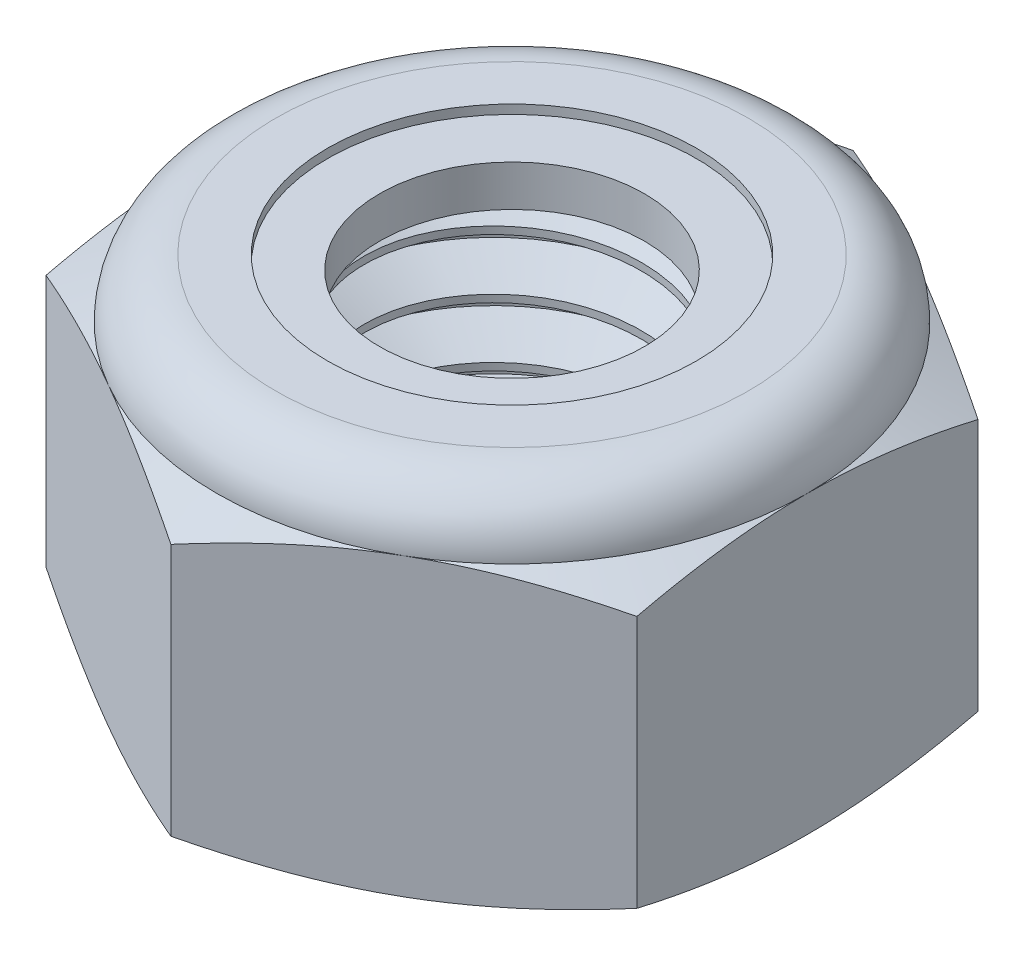
from build123d import *

# Parameters (mm, degrees)
EXTRUDE1_DEPTH   = 6
SKETCH2_W        = 3
SKETCH2_H        = 6
CUT_SWEEP1_PITCH = 1


with BuildPart() as part:
    # Sketch1 → Extrude1 (new body)
    with BuildSketch(Plane(origin=(0, 0, 0), x_dir=(1, 0, 0), z_dir=(0, 1, 0))):
        Polygon((0, 5.773502692), (-5, 2.886751346), (-5, -2.886751346), (0, -5.773502692), (5, -2.886751346), (5, 2.886751346), align=None)
    extrude(amount=EXTRUDE1_DEPTH)


with BuildPart() as body_2:
    # Sketch2 → Revolve1 (revolve)
    with BuildSketch(Plane(origin=(0, 0, 0), x_dir=(0, 0, -1), z_dir=(1, 0, 0))):
        with Locations((1.5, 3)):
            Rectangle(SKETCH2_W, SKETCH2_H)
    revolve(axis=Axis((0, -3, 0), (0, 1, 0)))

    # Boss-Extrude1 cone 1 section (through the dimple's axis) → Boss-Extrude1 (revolve)
    with BuildSketch(Plane(origin=(0, 0, 0), x_dir=(0, 0, -1), z_dir=(1, 0, 0))):
        Polygon((0, 0), (3, 0), (0, 3), align=None)
    revolve(axis=Axis((0, 0, 0), (0, 1, 0)))

    # Boss-Extrude2 cone 1 section (through the dimple's axis) → Boss-Extrude2 (revolve)
    with BuildSketch(Plane(origin=(0, 6, 0), x_dir=(0, 0, 1), z_dir=(1, 0, 0))):
        Polygon((0, 0), (3, 0), (0, 3), align=None)
    revolve(axis=Axis((0, 6, 0), (0, -1, 0)))

    # Cut-Sweep1: the profile of Sketch9 profile screwed along a right-hand helix of 7 turns, 8 arcs to a turn; built about Z, then put on its axis
    cut_sweep1_z = Axis((0, 0, 0), (0, 0, 1))
    cut_sweep1_corners = [(3.0003, 0, -0.875173205), (3.0003, 0, 0.000173205), (2.350480947, 0, -0.375), (2.350480947, 0, -0.5)]
    with BuildLine(mode=Mode.PRIVATE) as cut_sweep1_profile:
        Line(cut_sweep1_corners[0], cut_sweep1_corners[1])
        Line(cut_sweep1_corners[1], cut_sweep1_corners[2])
        Line(cut_sweep1_corners[2], cut_sweep1_corners[3])
        Line(cut_sweep1_corners[3], cut_sweep1_corners[0])
    cut_sweep1_cap = Face(cut_sweep1_profile.wire())
    cut_sweep1_turn_angles = [0, 22.5, 45, 67.5, 90, 112.5, 135, 157.5, 180, 202.5, 225, 247.5, 270, 292.5, 315, 337.5, 360]
    cut_sweep1_turn_weights = [1, 0.9238795325112867, 1, 0.9238795325112867, 1, 0.9238795325112867, 1, 0.9238795325112867, 1, 0.9238795325112867, 1, 0.9238795325112867, 1, 0.9238795325112867, 1, 0.9238795325112867, 1]
    cut_sweep1_turn_rails = [Edge.make_bspline([Vector(p[0], p[1], 0).rotate(cut_sweep1_z, cut_sweep1_turn_angles[k]) / cut_sweep1_turn_weights[k] + Vector(0, 0, p[2] + CUT_SWEEP1_PITCH * cut_sweep1_turn_angles[k] / 360) for k in range(17)], [0, 0, 0, 1, 1, 2, 2, 3, 3, 4, 4, 5, 5, 6, 6, 7, 7, 8, 8, 8], 2, cut_sweep1_turn_weights) for p in cut_sweep1_corners]
    cut_sweep1_turn_sides = [Face.make_surface_from_curves(cut_sweep1_turn_rails[p[0]], cut_sweep1_turn_rails[p[1]]) for p in [(0, 1), (1, 2), (2, 3), (3, 0)]]
    cut_sweep1 = Plane(origin=(0, 0, 0), x_dir=(0, 0, -1), z_dir=(0, 1, 0)) * Solid(Shell([*[p.moved(Location((0, 0, CUT_SWEEP1_PITCH * i))) for i in range(7) for p in cut_sweep1_turn_sides], cut_sweep1_cap, cut_sweep1_cap.rotate(cut_sweep1_z, 2520).moved(Location((0, 0, CUT_SWEEP1_PITCH * 2520 / 360)))]))
    add(cut_sweep1, mode=Mode.SUBTRACT)


with BuildPart() as part_1:
    add(part.part)

    # Combine1: cut body 2
    add(body_2.part, mode=Mode.SUBTRACT)

    # Sketch5 → Cut-Revolve3 (revolve, cut)
    with BuildSketch(Plane(origin=(0, 0, 0), x_dir=(0, 0, -1), z_dir=(1, 0, 0))):
        with BuildLine():
            Line((0, 0), (5, 0))
            Line((5, 0), (5.773502692, 0.360690229))
            Line((5.773502692, 0.360690229), (5.773502692, 4.639309771))
            Line((5.773502692, 4.639309771), (5, 5))
            ThreePointArc((5, 5), (4.707106781, 5.707106781), (4, 6))
            Line((4, 6), (4, 7.27))
            Line((4, 7.27), (7.043502692, 7.27))
            Line((7.043502692, 7.27), (7.043502692, -1.27))
            Line((7.043502692, -1.27), (0, -1.27))
            Line((0, -1.27), (0, 0))
        make_face()
    revolve(axis=Axis((0, 0, 0), (0, 1, 0)), mode=Mode.SUBTRACT)

    # Sketch6 → Cut-Revolve4 (revolve, cut)
    with BuildSketch(Plane(origin=(0, 0, 0), x_dir=(0, 0, -1), z_dir=(1, 0, 0)), mode=Mode.PRIVATE) as cut_revolve4_sk:
        with BuildLine():
            Line((0, 5), (4.8476, 5))
            ThreePointArc((4.8476, 5), (4.599343708, 5.599343708), (4, 5.8476))
            Line((4, 5.8476), (3.121113886, 5.8476))
            Line((3.121113886, 5.8476), (3.121113886, 7.27))
            Line((3.121113886, 7.27), (0, 7.27))
            Line((0, 7.27), (0, 5))
        make_face()
    revolve(cut_revolve4_sk.sketch.rotate(Axis((0, 7.27, 0), (0, -1, 0)), 180), axis=Axis((0, 7.27, 0), (0, -1, 0)), mode=Mode.SUBTRACT)


with BuildPart() as body_2_2:
    # Sketch7 → Revolve2 (revolve)
    with BuildSketch(Plane(origin=(0, 0, 0), x_dir=(0, 0, -1), z_dir=(1, 0, 0))):
        with BuildLine():
            Line((2.242227772, 5.0762), (4.767627201, 5.0762))
            ThreePointArc((4.767627201, 5.0762), (4.51782105, 5.57176859), (4, 5.7714))
            Line((4, 5.7714), (2.242227772, 5.7714))
            Line((2.242227772, 5.7714), (2.242227772, 5.0762))
        make_face()
    revolve(axis=Axis((0, 5.0762, 0), (0, 1, 0)))


solid = Compound([part_1.part, body_2_2.part])
